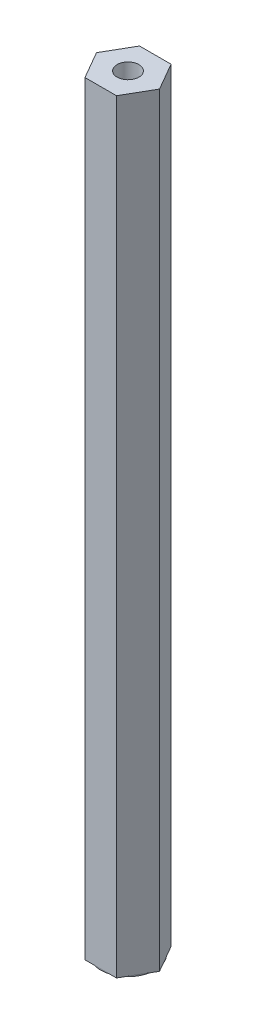
from build123d import *

# Parameters (mm, degrees)
BOSS_EXTRUDE1_DEPTH = 177.8
SKETCH2_R           = 2.54
CUT_EXTRUDE1_DEPTH  = 25.4
SKETCH3_R           = 6.35
BOSS_EXTRUDE2_DEPTH = 0.254


with BuildPart() as part:
    # Sketch1 → Boss-Extrude1 (new body)
    with BuildSketch(Plane(origin=(0, 0, 0), x_dir=(1, 0, 0), z_dir=(0, 1, 0))):
        Polygon((7.332348419, 0), (3.666174209, 6.35), (-3.666174209, 6.35), (-7.332348419, 0), (-3.666174209, -6.35), (3.666174209, -6.35), align=None)
    extrude(amount=BOSS_EXTRUDE1_DEPTH)

    # Sketch2 → Cut-Extrude1 (cut)
    with BuildSketch(Plane(origin=(0, 177.8, 0), x_dir=(1, 0, 0), z_dir=(0, 1, 0))):
        Circle(SKETCH2_R)
    extrude(amount=-CUT_EXTRUDE1_DEPTH, mode=Mode.SUBTRACT)

    # Sketch3 → Boss-Extrude2 (add)
    with BuildSketch(Plane.XZ):
        Circle(SKETCH3_R)
    extrude(amount=BOSS_EXTRUDE2_DEPTH)


solid = part.part
